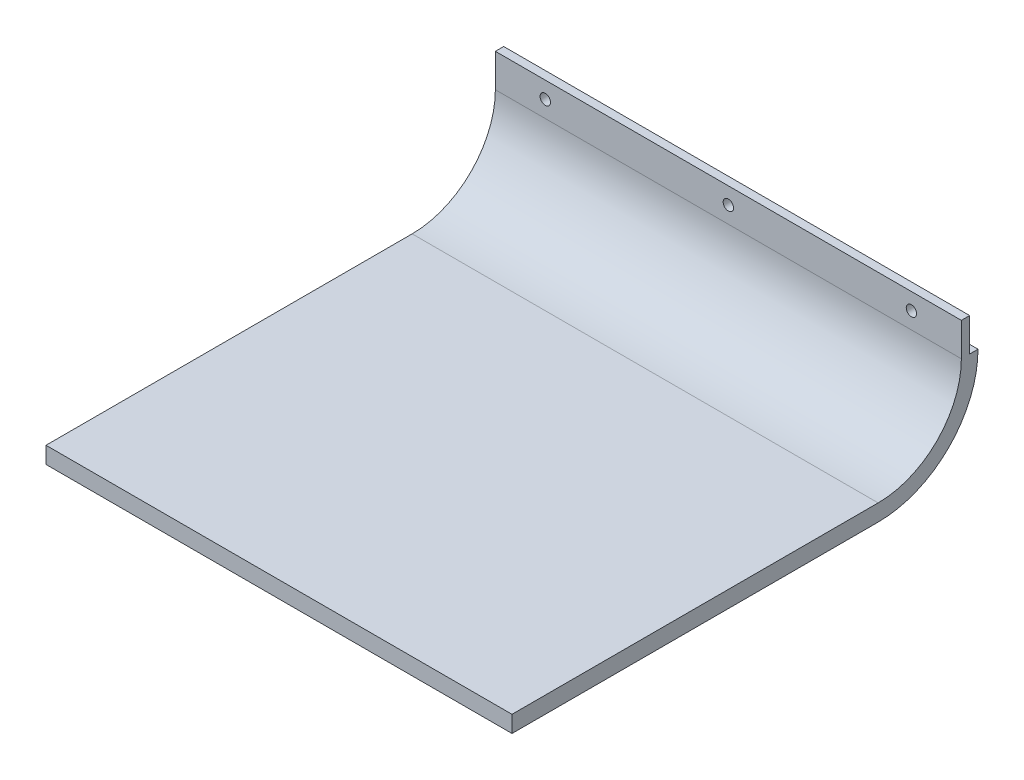
from build123d import *

# Parameters (mm, degrees)
BOSS_EXTRUDE1_DEPTH      = 177.8
BOSS_EXTRUDE1_DEPTH_BACK = 177.8
SKETCH2_W                = 355.6
SKETCH2_H                = 6.35
BOSS_EXTRUDE2_DEPTH      = 25.4
SKETCH3_R                = 3.96875
CUT_EXTRUDE1_DEPTH       = 25.4


with BuildPart() as part:
    # Sketch1 → Boss-Extrude1 (new, two sides: drawn at the far end of the back side and taken through both)
    with BuildSketch(Plane(origin=(0, 0, 0), x_dir=(0, 0, -1), z_dir=(1, 0, 0)).offset(-BOSS_EXTRUDE1_DEPTH_BACK)):
        with BuildLine():
            Line((-139.7, 0), (139.7, 0))
            ThreePointArc((139.7, 0), (193.581536726, 22.318463274), (215.9, 76.2))
            Line((215.9, 76.2), (203.2, 76.2))
            ThreePointArc((203.2, 76.2), (184.601280605, 31.298719395), (139.7, 12.7))
            Line((139.7, 12.7), (-139.7, 12.7))
            Line((-139.7, 12.7), (-139.7, 0))
        make_face()
    extrude(amount=BOSS_EXTRUDE1_DEPTH + BOSS_EXTRUDE1_DEPTH_BACK)

    # Sketch2 → Boss-Extrude2 (add)
    with BuildSketch(Plane(origin=(0, 76.2, 0), x_dir=(1, 0, 0), z_dir=(0, 1, 0))):
        with Locations((0, 206.375)):
            Rectangle(SKETCH2_W, SKETCH2_H)
    extrude(amount=BOSS_EXTRUDE2_DEPTH)

    # Sketch3 → Cut-Extrude1 (cut)
    with BuildSketch(Plane(origin=(0, 0, -209.55), x_dir=(-1, 0, 0), z_dir=(0, 0, -1))):
        with Locations((-139.7, 88.9)):
            Circle(SKETCH3_R)
        with Locations((139.7, 88.9)):
            Circle(SKETCH3_R)
        with Locations((0, 88.9)):
            Circle(SKETCH3_R)
    extrude(amount=-CUT_EXTRUDE1_DEPTH, mode=Mode.SUBTRACT)


solid = part.part
